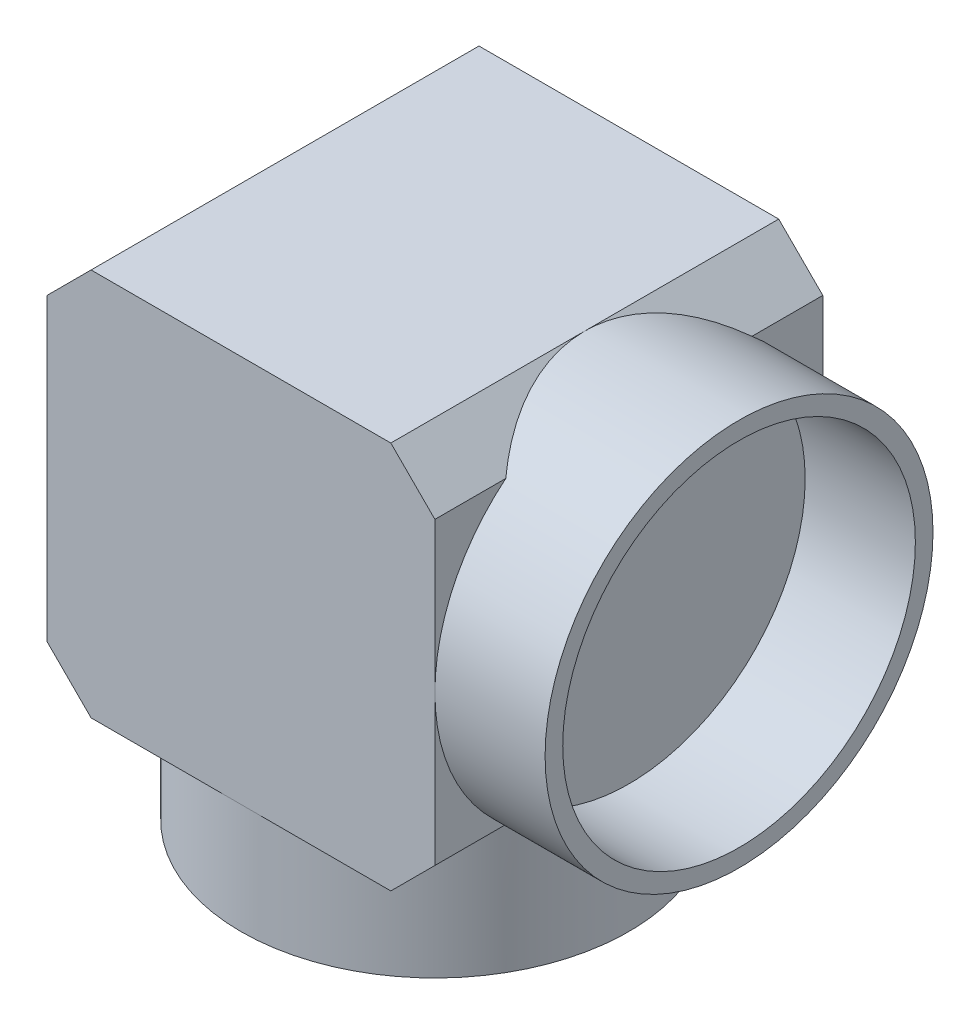
from build123d import *

# Parameters (mm, degrees)
SKETCH1_R           = 44
SKETCH1_R_2         = 40
BOSS_EXTRUDE1_DEPTH = 25
SKETCH2_R           = 44
SKETCH2_R_2         = 40
BOSS_EXTRUDE2_DEPTH = 25
SKETCH3_W           = 88
SKETCH3_H           = 88
BOSS_EXTRUDE3_DEPTH = 88
CHAMFER2_SIZE       = 10


with BuildPart() as part:
    # Sketch1 → Boss-Extrude1 (new body)
    with BuildSketch(Plane(origin=(0, 0, 0), x_dir=(1, 0, 0), z_dir=(0, 1, 0))):
        with Locations(Location((0, 0, 0), (0, 0, 270))):
            Circle(SKETCH1_R)
        with Locations(Location((0, 0, 0), (0, 0, 270))):
            Circle(SKETCH1_R_2, mode=Mode.SUBTRACT)
    extrude(amount=BOSS_EXTRUDE1_DEPTH)



with BuildPart() as body_2:
    # Sketch2 → Boss-Extrude2 (new body)
    with BuildSketch(Plane(origin=(44, 0, 0), x_dir=(0, 0, -1), z_dir=(1, 0, 0))):
        with Locations((0, 69)):
            Circle(SKETCH2_R)
        with Locations((0, 69)):
            Circle(SKETCH2_R_2, mode=Mode.SUBTRACT)
    extrude(amount=BOSS_EXTRUDE2_DEPTH)


with BuildPart() as part_1:
    add(part.part)

    add(body_2.part)  # Boss-Extrude3 merges body 2
    # Sketch3 → Boss-Extrude3 (add)
    with BuildSketch(Plane(origin=(0, 25, 0), x_dir=(1, 0, 0), z_dir=(0, 1, 0))):
        Rectangle(SKETCH3_W, SKETCH3_H)
    extrude(amount=BOSS_EXTRUDE3_DEPTH)

    # Chamfer2
    # the kernel refuses this chamfer: 10 mm, written as the material it takes off along each edge
    with BuildSketch(Plane(origin=(-44, 25, 8.9e-08), x_dir=(0.9996219169112968, -0.027495876610586317, 0), z_dir=(0, 0, -1))) as chamfer2_piece_1_section:
        Polygon((CHAMFER2_SIZE * 0.999621916911, -CHAMFER2_SIZE * 0.0274958766106), (-CHAMFER2_SIZE * 0.0274958766106, -CHAMFER2_SIZE * 0.999621916911), (0, 0), align=None)
    chamfer2_piece_1 = extrude(amount=69.716829969, mode=Mode.PRIVATE)
    chamfer2_piece_1 = chamfer2_piece_1 - Plane(origin=(0, 28.58171052, 0), x_dir=(0, 0, 1), z_dir=(0, -1, 0)) * Cylinder(44, 180, mode=Mode.PRIVATE)
    add(chamfer2_piece_1, mode=Mode.SUBTRACT)
    with BuildSketch(Plane(origin=(-44, 25, 69.71682988), x_dir=(0.9996219169112968, -0.027495876610586317, 0), z_dir=(0, 0, -1))) as chamfer2_piece_2_section:
        Polygon((CHAMFER2_SIZE * 0.999621916911, -CHAMFER2_SIZE * 0.0274958766106), (-CHAMFER2_SIZE * 0.0274958766106, -CHAMFER2_SIZE * 0.999621916911), (0, 0), align=None)
    chamfer2_piece_2 = extrude(amount=69.716829791, mode=Mode.PRIVATE)
    chamfer2_piece_2 = chamfer2_piece_2 - Plane(origin=(0, 28.58171052, 0), x_dir=(0, 0, 1), z_dir=(0, -1, 0)) * Cylinder(44, 180, mode=Mode.PRIVATE)
    add(chamfer2_piece_2, mode=Mode.SUBTRACT)
    with BuildSketch(Plane(origin=(44, 25, -1.49e-07), x_dir=(-0.9996219169112968, -0.027495876610586317, 0), z_dir=(0, 0, 1))) as chamfer2_piece_3_section:
        Polygon((CHAMFER2_SIZE * 0.999621916911, -CHAMFER2_SIZE * 0.0274958766106), (-CHAMFER2_SIZE * 0.0274958766106, -CHAMFER2_SIZE * 0.999621916911), (0, 0), align=None)
    chamfer2_piece_3 = extrude(amount=69.716830028, mode=Mode.PRIVATE)
    chamfer2_piece_3 = chamfer2_piece_3 - Plane(origin=(0, 28.146935755, 0), x_dir=(0, 0, 1), z_dir=(0, -1, 0)) * Cylinder(44, 180, mode=Mode.PRIVATE)
    chamfer2_piece_3 = chamfer2_piece_3 - Plane(origin=(40.853064245, 69, 0), x_dir=(0, 0, -1), z_dir=(-1, 0, 0)) * Cylinder(44, 180, mode=Mode.PRIVATE)
    add(chamfer2_piece_3, mode=Mode.SUBTRACT)
    with BuildSketch(Plane(origin=(44, 25, -69.71682988), x_dir=(-0.9996219169112968, -0.027495876610586317, 0), z_dir=(0, 0, 1))) as chamfer2_piece_4_section:
        Polygon((CHAMFER2_SIZE * 0.999621916911, -CHAMFER2_SIZE * 0.0274958766106), (-CHAMFER2_SIZE * 0.0274958766106, -CHAMFER2_SIZE * 0.999621916911), (0, 0), align=None)
    chamfer2_piece_4 = extrude(amount=69.716829731, mode=Mode.PRIVATE)
    chamfer2_piece_4 = chamfer2_piece_4 - Plane(origin=(0, 28.146935758, 0), x_dir=(0, 0, 1), z_dir=(0, -1, 0)) * Cylinder(44, 180, mode=Mode.PRIVATE)
    chamfer2_piece_4 = chamfer2_piece_4 - Plane(origin=(40.853064242, 69, 0), x_dir=(0, 0, -1), z_dir=(-1, 0, 0)) * Cylinder(44, 180, mode=Mode.PRIVATE)
    add(chamfer2_piece_4, mode=Mode.SUBTRACT)
    with BuildSketch(Plane(origin=(-44, 113, 69.71682988), x_dir=(-0.027495876610586317, -0.9996219169112968, 0), z_dir=(0, 0, -1))) as chamfer2_piece_5:
        Polygon((CHAMFER2_SIZE * 0.999621916911, -CHAMFER2_SIZE * 0.0274958766106), (-CHAMFER2_SIZE * 0.0274958766106, -CHAMFER2_SIZE * 0.999621916911), (0, 0), align=None)
    extrude(amount=139.433659759, mode=Mode.SUBTRACT)
    with BuildSketch(Plane(origin=(44, 113, -1.44e-07), x_dir=(-0.9996219169112968, 0.027495876610586317, 0), z_dir=(0, 0, 1))) as chamfer2_piece_6_section:
        Polygon((CHAMFER2_SIZE * 0.999621916911, CHAMFER2_SIZE * 0.0274958766106), (-CHAMFER2_SIZE * 0.0274958766106, CHAMFER2_SIZE * 0.999621916911), (0, 0), align=None)
    chamfer2_piece_6 = extrude(amount=69.716830024, mode=Mode.PRIVATE)
    chamfer2_piece_6 = chamfer2_piece_6 - Plane(origin=(40.41828948, 69, 0), x_dir=(0, 0, -1), z_dir=(-1, 0, 0)) * Cylinder(44, 180, mode=Mode.PRIVATE)
    add(chamfer2_piece_6, mode=Mode.SUBTRACT)
    with BuildSketch(Plane(origin=(44, 113, -69.71682988), x_dir=(-0.9996219169112968, 0.027495876610586317, 0), z_dir=(0, 0, 1))) as chamfer2_piece_7_section:
        Polygon((CHAMFER2_SIZE * 0.999621916911, CHAMFER2_SIZE * 0.0274958766106), (-CHAMFER2_SIZE * 0.0274958766106, CHAMFER2_SIZE * 0.999621916911), (0, 0), align=None)
    chamfer2_piece_7 = extrude(amount=69.716829736, mode=Mode.PRIVATE)
    chamfer2_piece_7 = chamfer2_piece_7 - Plane(origin=(40.41828948, 69, 0), x_dir=(0, 0, -1), z_dir=(-1, 0, 0)) * Cylinder(44, 180, mode=Mode.PRIVATE)
    add(chamfer2_piece_7, mode=Mode.SUBTRACT)


solid = part_1.part
